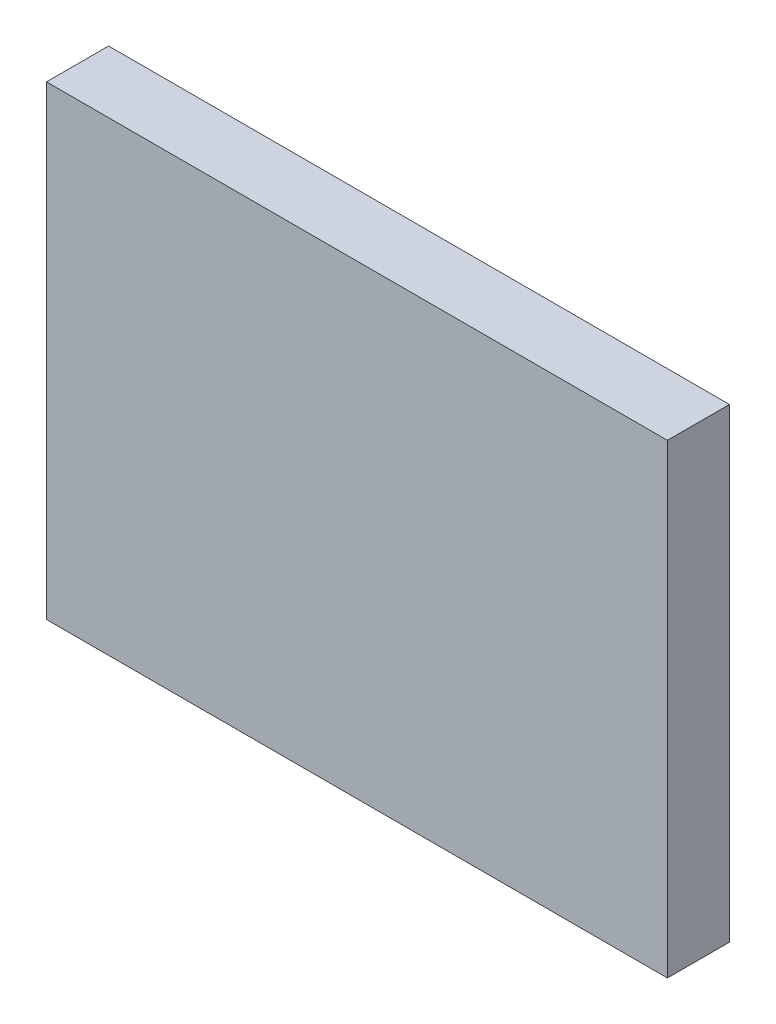
from build123d import *

# Parameters (mm, degrees)
SKETCH1_W           = 60
SKETCH1_H           = 45
BOSS_EXTRUDE1_DEPTH = 6


with BuildPart() as part:
    # Sketch1 → Boss-Extrude1 (new body)
    with BuildSketch(Plane.XY):
        with Locations((30, 22.5)):
            Rectangle(SKETCH1_W, SKETCH1_H)
    extrude(amount=BOSS_EXTRUDE1_DEPTH)


solid = part.part
